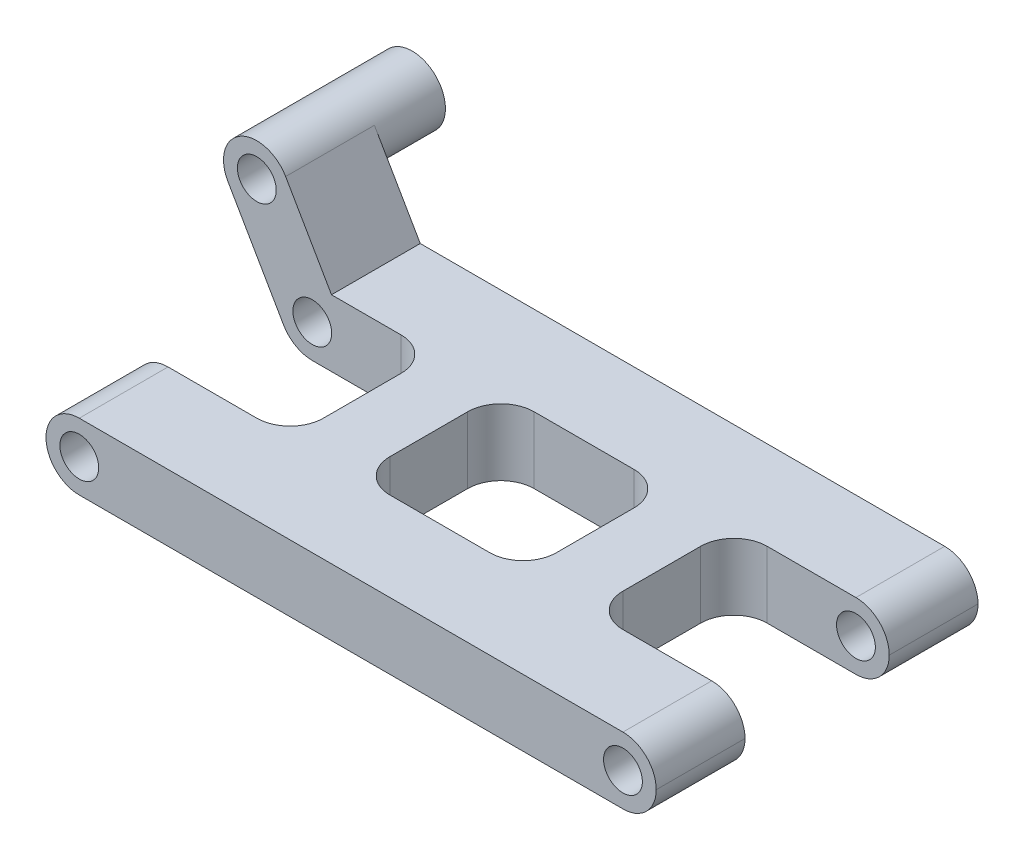
from build123d import *
from build123d.topology import SkipClean

# Parameters (mm, degrees)
CROQUIS1_W                 = 15
CROQUIS1_H                 = 13
SALIENTE_EXTRUIR1_DEPTH    = 3
REDONDEO1_R                = 3
CORTAR_EXTRUIR1_DEPTH      = 63.24949799
CORTAR_EXTRUIR1_DEPTH_BACK = 63.24949799
CROQUIS2_R                 = 1.75
CORTAR_EXTRUIR2_DEPTH      = 63.24949799
CORTAR_EXTRUIR2_DEPTH_BACK = 63.24949799
CROQUIS3_R                 = 1.75
REDONDEO2_R                = 3
SALIENTE_EXTRUIR2_START    = -21
CROQUIS5_R                 = 1.75
SALIENTE_EXTRUIR2_DEPTH    = 8
SALIENTE_EXTRUIR3_START    = -29
CROQUIS6_R                 = 3
CROQUIS6_R_2               = 1.75
SALIENTE_EXTRUIR3_DEPTH    = 6


with BuildPart() as part:
    # Croquis1 → Saliente-Extruir1 (new, symmetric)
    with BuildSketch(Plane(origin=(0, 0, 0), x_dir=(1, 0, 0), z_dir=(0, 1, 0))):
        Polygon((0, 0), (0, 8), (14, 8), (14, 21), (0, 21), (0, 29), (55, 29), (55, 21), (41, 21), (41, 8), (55, 8), (55, 0), align=None)
        with Locations((27.5, 14.5)):
            Rectangle(CROQUIS1_W, CROQUIS1_H, mode=Mode.SUBTRACT)
    extrude(amount=SALIENTE_EXTRUIR1_DEPTH, both=True)

    # Redondeo1
    redondeo1_edges = [part.edges().sort_by_distance(p)[0] for p in [
        (0, -3, -4),
        (0, 3, -4),
        (0, -3, -25),
        (0, 3, -25),
        (55, -3, -4),
        (55, 3, -4),
        (55, 3, -25),
        (55, -3, -25),
    ]]
    fillet(redondeo1_edges, radius=REDONDEO1_R - 0.0001)  # a hair under: the kernel refuses the full size

    # Croquis2 → Cortar-Extruir1 (cut, two sides: drawn at the far end of the back side and taken through both)
    with BuildSketch(Plane.XY.offset(-CORTAR_EXTRUIR1_DEPTH_BACK)):
        with Locations((3, 0)):
            Circle(CROQUIS2_R)
    extrude(amount=CORTAR_EXTRUIR1_DEPTH + CORTAR_EXTRUIR1_DEPTH_BACK, mode=Mode.SUBTRACT)

    # Croquis3 → Cortar-Extruir2 (cut, two sides: drawn at the far end of the back side and taken through both)
    with BuildSketch(Plane.XY.offset(-CORTAR_EXTRUIR2_DEPTH_BACK)):
        with Locations((52, 0)):
            Circle(CROQUIS3_R)
    extrude(amount=CORTAR_EXTRUIR2_DEPTH + CORTAR_EXTRUIR2_DEPTH_BACK, mode=Mode.SUBTRACT)

    # Redondeo2
    redondeo2_edges = [part.edges().sort_by_distance(p)[0] for p in [
        (14, 0, -8),
        (14, 0, -21),
        (41, 0, -21),
        (41, 0, -8),
        (20, 0, -21),
        (20, 0, -8),
        (35, 0, -8),
        (35, 0, -21),
    ]]
    fillet(redondeo2_edges, radius=REDONDEO2_R)

    # Croquis5 → Saliente-Extruir2 (add)
    with BuildSketch(Plane.XY.offset(SALIENTE_EXTRUIR2_START)):
        with BuildLine():
            Line((0.598076211, 10.160254038), (5.598076211, 1.5))
            ThreePointArc((5.598076211, 1.5), (4.5, -2.598076211), (0.401923789, -1.5))
            Line((0.401923789, -1.5), (-4.598076211, 7.160254038))
            ThreePointArc((-4.598076211, 7.160254038), (-3.5, 11.258330249), (0.598076211, 10.160254038))
        make_face()
        with Locations(Location((-2, 8.660254038, 0), (0, 0, 180))):
            Circle(CROQUIS5_R, mode=Mode.SUBTRACT)
        with Locations((3, 0)):
            Circle(CROQUIS5_R, mode=Mode.SUBTRACT)
    extrude(amount=-SALIENTE_EXTRUIR2_DEPTH)

    # Croquis6 → Saliente-Extruir3 (add)
    with SkipClean():  # the faces are left unmerged after this step: merging them gives an invalid solid
        with BuildSketch(Plane.XY.offset(SALIENTE_EXTRUIR3_START)):
            with Locations((-2, 8.660254038)):
                Circle(CROQUIS6_R)
            with Locations((-2, 8.660254038)):
                Circle(CROQUIS6_R_2, mode=Mode.SUBTRACT)
        extrude(amount=-SALIENTE_EXTRUIR3_DEPTH)


solid = part.part
